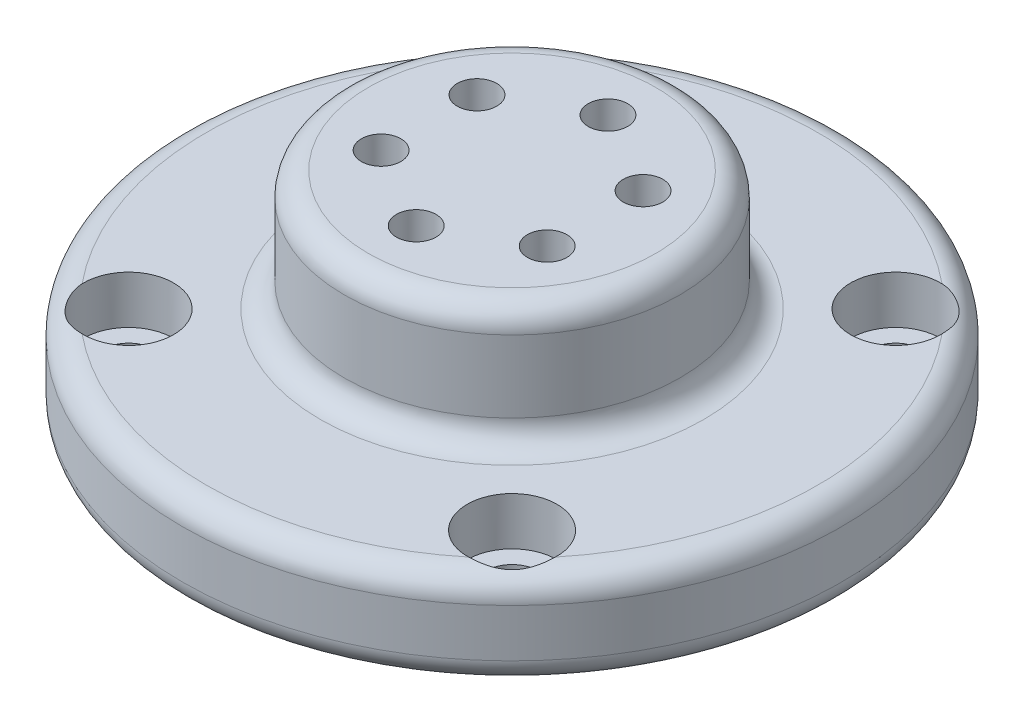
from build123d import *

# Parameters (mm, degrees)
SKETCH1_R           = 27.5
SKETCH1_R_2         = 1.65
SKETCH1_R_3         = 2.15
BOSS_EXTRUDE1_DEPTH = 8
SKETCH2_R           = 14
SKETCH2_R_2         = 1.65
BOSS_EXTRUDE2_DEPTH = 10
SKETCH3_R           = 3
CUT_EXTRUDE1_DEPTH  = 12
SKETCH4_R           = 3.75
CUT_EXTRUDE2_DEPTH  = 4
FILLET1_R           = 2


with BuildPart() as part:
    # Sketch1 → Boss-Extrude1 (new body)
    with BuildSketch(Plane(origin=(0, 0, 0), x_dir=(1, 0, 0), z_dir=(0, 1, 0))):
        with Locations(Location((0, 0, 0), (0, 0, 270))):
            Circle(SKETCH1_R)
        with Locations(Location((-6.92820323, 4, 0), (0, 0, 270))):
            Circle(SKETCH1_R_2, mode=Mode.SUBTRACT)
        with Locations(Location((0, 8, 0), (0, 0, 270))):
            Circle(SKETCH1_R_2, mode=Mode.SUBTRACT)
        with Locations(Location((6.92820323, 4, 0), (0, 0, 270))):
            Circle(SKETCH1_R_2, mode=Mode.SUBTRACT)
        with Locations(Location((6.92820323, -4, 0), (0, 0, 270))):
            Circle(SKETCH1_R_2, mode=Mode.SUBTRACT)
        with Locations(Location((0, -8, 0), (0, 0, 270))):
            Circle(SKETCH1_R_2, mode=Mode.SUBTRACT)
        with Locations(Location((-6.92820323, -4, 0), (0, 0, 270))):
            Circle(SKETCH1_R_2, mode=Mode.SUBTRACT)
        with Locations(Location((-16, 16, 0), (0, 0, 270))):
            Circle(SKETCH1_R_3, mode=Mode.SUBTRACT)
        with Locations(Location((16, 16, 0), (0, 0, 270))):
            Circle(SKETCH1_R_3, mode=Mode.SUBTRACT)
        with Locations(Location((16, -16, 0), (0, 0, 270))):
            Circle(SKETCH1_R_3, mode=Mode.SUBTRACT)
        with Locations(Location((-16, -16, 0), (0, 0, 270))):
            Circle(SKETCH1_R_3, mode=Mode.SUBTRACT)
    extrude(amount=BOSS_EXTRUDE1_DEPTH)

    # Sketch2 → Boss-Extrude2 (add)
    with BuildSketch(Plane(origin=(0, 8, 0), x_dir=(1, 0, 0), z_dir=(0, 1, 0))):
        with Locations(Location((0, 0, 0), (0, 0, 270))):
            Circle(SKETCH2_R)
        with Locations(Location((-6.92820323, -4, 0), (0, 0, 270))):
            Circle(SKETCH2_R_2, mode=Mode.SUBTRACT)
        with Locations(Location((0, -8, 0), (0, 0, 270))):
            Circle(SKETCH2_R_2, mode=Mode.SUBTRACT)
        with Locations(Location((6.92820323, -4, 0), (0, 0, 270))):
            Circle(SKETCH2_R_2, mode=Mode.SUBTRACT)
        with Locations(Location((6.92820323, 4, 0), (0, 0, 270))):
            Circle(SKETCH2_R_2, mode=Mode.SUBTRACT)
        with Locations(Location((0, 8, 0), (0, 0, 270))):
            Circle(SKETCH2_R_2, mode=Mode.SUBTRACT)
        with Locations(Location((-6.92820323, 4, 0), (0, 0, 270))):
            Circle(SKETCH2_R_2, mode=Mode.SUBTRACT)
    extrude(amount=BOSS_EXTRUDE2_DEPTH)

    # Sketch3 → Cut-Extrude1 (cut)
    with BuildSketch(Plane.XZ):
        with Locations(Location((0, 8, 0), (0, 0, 270))):
            Circle(SKETCH3_R)
        with Locations(Location((6.92820323, 4, 0), (0, 0, 270))):
            Circle(SKETCH3_R)
        with Locations(Location((6.92820323, -4, 0), (0, 0, 270))):
            Circle(SKETCH3_R)
        with Locations(Location((0, -8, 0), (0, 0, 270))):
            Circle(SKETCH3_R)
        with Locations(Location((-6.92820323, -4, 0), (0, 0, 270))):
            Circle(SKETCH3_R)
        with Locations(Location((-6.92820323, 4, 0), (0, 0, 270))):
            Circle(SKETCH3_R)
    extrude(amount=-CUT_EXTRUDE1_DEPTH, mode=Mode.SUBTRACT)

    # Sketch4 → Cut-Extrude2 (cut)
    with BuildSketch(Plane(origin=(0, 8, 0), x_dir=(1, 0, 0), z_dir=(0, 1, 0))):
        with Locations(Location((-16, 16, 0), (0, 0, 270))):
            Circle(SKETCH4_R)
        with Locations(Location((16, 16, 0), (0, 0, 270))):
            Circle(SKETCH4_R)
        with Locations(Location((16, -16, 0), (0, 0, 270))):
            Circle(SKETCH4_R)
        with Locations(Location((-16, -16, 0), (0, 0, 270))):
            Circle(SKETCH4_R)
    extrude(amount=-CUT_EXTRUDE2_DEPTH, mode=Mode.SUBTRACT)

    # Fillet1
    # the kernel refuses this fillet: 2 mm, written as the material it adds along each edge
    with BuildSketch(Plane(origin=(0, 8, 0), x_dir=(0, 0, 1), z_dir=(-1, 0, 0))) as fillet1_piece_1:
        with BuildLine():
            CenterArc((14 + FILLET1_R, FILLET1_R), FILLET1_R, 180, 90)
            Line((14, FILLET1_R), (14, 0))
            Line((14, 0), (14 + FILLET1_R, 0))
        make_face()
    revolve(axis=Axis((0, 8, 0), (0, 1, 0)))
    # the kernel refuses this fillet: 2 mm, written as the material it takes off along each edge
    with BuildSketch(Plane(origin=(0, 0, 0), x_dir=(0, 0, 1), z_dir=(-1, 0, 0))) as fillet1_2_piece_1:
        with BuildLine():
            CenterArc((27.5 - FILLET1_R, FILLET1_R), FILLET1_R, 270, 90)
            Line((27.5 - FILLET1_R, 0), (27.5, 0))
            Line((27.5, 0), (27.5, FILLET1_R))
        make_face()
    revolve(axis=Axis((0, 0, 0), (0, 1, 0)), mode=Mode.SUBTRACT)
    with BuildSketch(Plane(origin=(0, 18, 0), x_dir=(0, 0, 1), z_dir=(-1, 0, 0))) as fillet1_2_piece_2:
        with BuildLine():
            CenterArc((14 - FILLET1_R, -FILLET1_R), FILLET1_R, 0, 90)
            Line((14 - FILLET1_R, 0), (14, 0))
            Line((14, 0), (14, -FILLET1_R))
        make_face()
    revolve(axis=Axis((0, 18, 0), (0, 1, 0)), mode=Mode.SUBTRACT)
    with BuildSketch(Plane(origin=(0, 8, 0), x_dir=(0, 0, 1), z_dir=(-1, 0, 0))) as fillet1_2_piece_3:
        with BuildLine():
            CenterArc((27.5 - FILLET1_R, -FILLET1_R), FILLET1_R, 0, 90)
            Line((27.5 - FILLET1_R, 0), (27.5, 0))
            Line((27.5, 0), (27.5, -FILLET1_R))
        make_face()
    revolve(axis=Axis((0, 8, 0), (0, 1, 0)), mode=Mode.SUBTRACT)


solid = part.part
